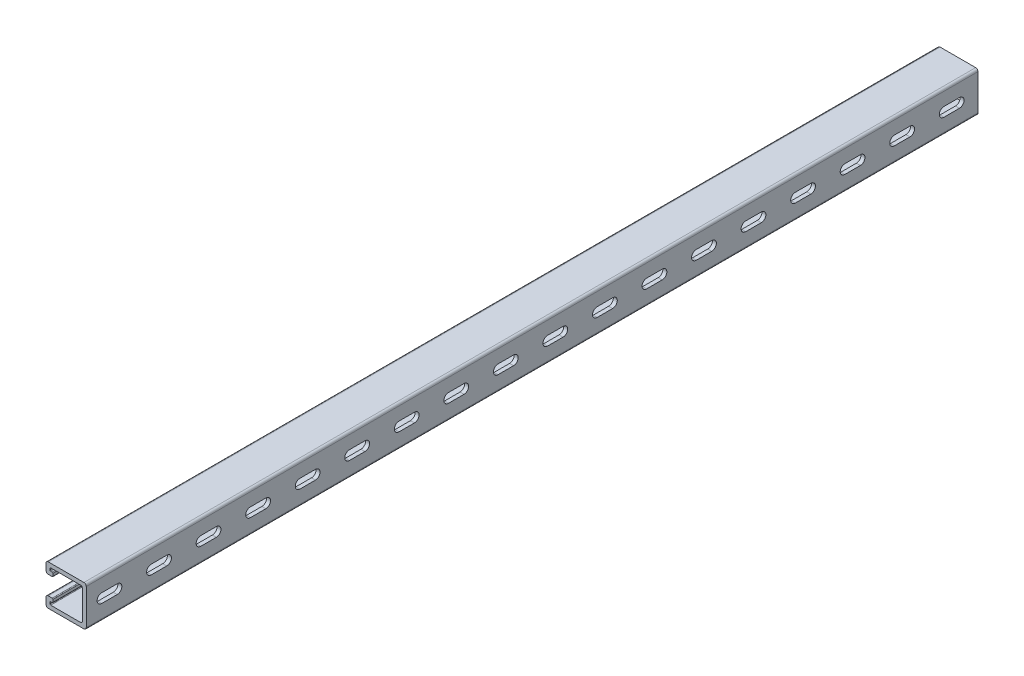
from build123d import *

# Parameters (mm, degrees)
EXTRUDE_THIN1_DEPTH = 914.4
FILLET2_R           = 0.762
FILLET3_R           = 1.524
CUT_EXTRUDE1_DEPTH  = 916.563701788
LPATTERN1_COUNT     = 18
LPATTERN1_PITCH     = 50.8


with BuildPart() as part:
    # Sketch1 → Extrude-Thin1 (new body)
    with BuildSketch(Plane.XY):
        with BuildLine():
            Line((-13.5255, 9.525), (-18.2499, 9.525))
            ThreePointArc((-18.2499, 9.525), (-19.938188151, 10.224311849), (-20.6375, 11.9126))
            Line((-20.6375, 11.9126), (-20.6375, 18.2499))
            ThreePointArc((-20.6375, 18.2499), (-19.938188151, 19.938188151), (-18.2499, 20.6375))
            Line((-18.2499, 20.6375), (18.2499, 20.6375))
            ThreePointArc((18.2499, 20.6375), (19.938188151, 19.938188151), (20.6375, 18.2499))
            Line((20.6375, 18.2499), (20.6375, -18.2499))
            ThreePointArc((20.6375, -18.2499), (19.938188151, -19.938188151), (18.2499, -20.6375))
            Line((18.2499, -20.6375), (-18.2499, -20.6375))
            ThreePointArc((-18.2499, -20.6375), (-19.938188151, -19.938188151), (-20.6375, -18.2499))
            Line((-20.6375, -18.2499), (-20.6375, -11.9126))
            ThreePointArc((-20.6375, -11.9126), (-19.938188151, -10.224311849), (-18.2499, -9.525))
            Line((-18.2499, -9.525), (-13.5255, -9.525))
            Line((-13.5255, -9.525), (-13.5255, -13.589))
            Line((-13.5255, -13.589), (-16.5735, -13.589))
            Line((-16.5735, -13.589), (-16.5735, -16.5735))
            Line((-16.5735, -16.5735), (16.5735, -16.5735))
            Line((16.5735, -16.5735), (16.5735, 16.5735))
            Line((16.5735, 16.5735), (-16.5735, 16.5735))
            Line((-16.5735, 16.5735), (-16.5735, 13.589))
            Line((-16.5735, 13.589), (-13.5255, 13.589))
            Line((-13.5255, 13.589), (-13.5255, 9.525))
        make_face()
    extrude(amount=-EXTRUDE_THIN1_DEPTH)

    # Fillet2
    fillet2_edges = [part.edges().sort_by_distance(p)[0] for p in [
        (-16.5735, 13.589, -457.2),
        (-16.5735, -16.5735, -457.2),
        (-16.5735, 16.5735, -457.2),
        (-13.5255, 13.589, -457.2),
        (-13.5255, 9.525, -457.2),
        (-13.5255, -9.525, -457.2),
        (-13.5255, -13.589, -457.2),
        (-16.5735, -13.589, -457.2),
    ]]
    fillet(fillet2_edges, radius=FILLET2_R)

    # Fillet3
    fillet3_edges = [part.edges().sort_by_distance(p)[0] for p in [
        (16.5735, 16.5735, -457.2),
        (16.5735, -16.5735, -457.2),
    ]]
    fillet(fillet3_edges, radius=FILLET3_R)

    # Sketch2 → Cut-Extrude1 (cut, through all)
    with BuildSketch(Plane(origin=(20.6375, 0, 0), x_dir=(0, 0, -1), z_dir=(1, 0, 0))):
        with BuildLine():
            Line((15.875, 4.7625), (31.75, 4.7625))
            ThreePointArc((31.75, 4.7625), (36.5125, 0), (31.75, -4.7625))
            Line((31.75, -4.7625), (15.875, -4.7625))
            ThreePointArc((15.875, -4.7625), (11.1125, 0), (15.875, 4.7625))
        make_face()
    cut_extrude1 = extrude(amount=-CUT_EXTRUDE1_DEPTH, mode=Mode.SUBTRACT)

    # LPattern1: Cut-Extrude1 ×18
    with Locations(*[(0, 0, -i * LPATTERN1_PITCH) for i in range(1, LPATTERN1_COUNT)]):
        add(cut_extrude1, mode=Mode.SUBTRACT)


solid = part.part
